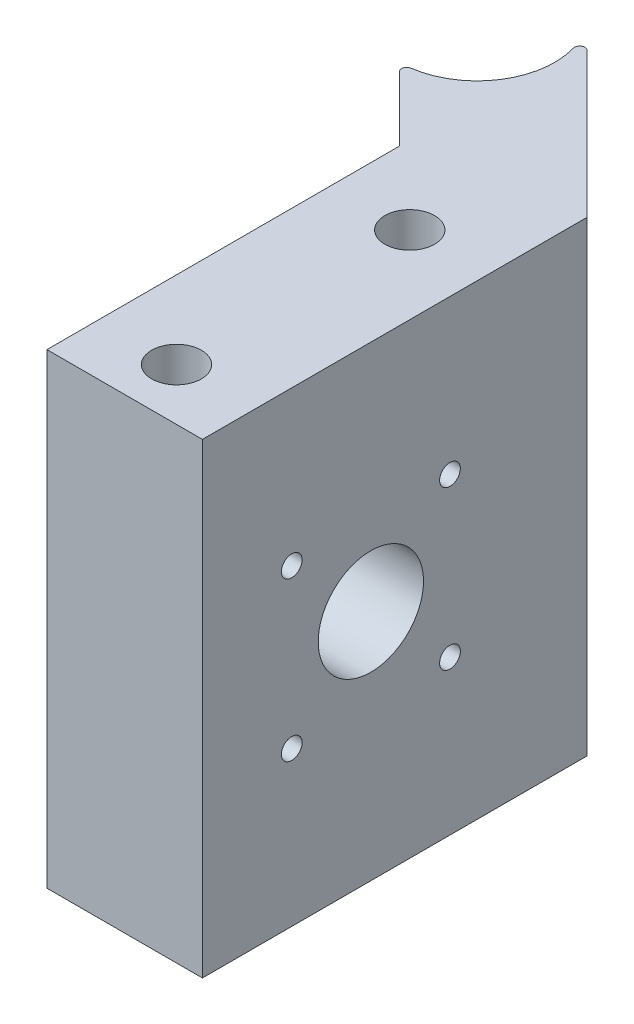
from build123d import *

# Parameters (mm, degrees)
SKETCH1_R           = 2.4
BOSS_EXTRUDE1_DEPTH = 45
CUT_EXTRUDE1_REACH  = 71.934
SKETCH2_R           = 5.0800000000000045
SKETCH2_R_2         = 1.0000000000000009
SKETCH2_R_3         = 1.0000000000000018
FILLET1_R           = 0.5
CUT_EXTRUDE2_DEPTH  = 2
CUT_EXTRUDE3_START  = 17
CUT_EXTRUDE3_DEPTH  = 2


with BuildPart() as part:
    # Sketch1 → Boss-Extrude1 (new body)
    with BuildSketch(Plane(origin=(0, 0, 0), x_dir=(1, 0, 0), z_dir=(0, 1, 0))):
        with BuildLine():
            Line((-7.499999999999999, -5.000000000000001), (7.500000000000001, -4.999999999999999))
            Line((7.500000000000001, -5), (7.4999999999999964, 32.10660171779804))
            Line((7.499999999999998, 32.10660171779804), (-9.196699141100867, 48.80330085889908))
            ThreePointArc((-9.196699141100867, 48.80330085889908), (-7.57090350616536, 40.62987425726181), (-14.499999999999998, 36))
            Line((-14.499999999999998, 36), (-7.5, 28.999999999999925))
            Line((-7.5, 28.99999999999993), (-7.499999999999999, -5.000000000000001))
        make_face()
        Circle(SKETCH1_R, mode=Mode.SUBTRACT)
        with Locations((0, 22.5)):
            Circle(SKETCH1_R, mode=Mode.SUBTRACT)
    extrude(amount=BOSS_EXTRUDE1_DEPTH)

    # Sketch2 → Cut-Extrude1 (cut, up to next)
    with BuildSketch(Plane(origin=(7.5, 0, -8.8e-16), x_dir=(-1.2e-16, 0, -1), z_dir=(1, 0, -1.2e-16)), mode=Mode.PRIVATE) as cut_extrude1_sk1:
        with Locations((11.25, 22.5)):
            Circle(SKETCH2_R)
    cut_extrude1_tool1 = extrude(cut_extrude1_sk1.sketch, amount=-CUT_EXTRUDE1_REACH, mode=Mode.PRIVATE) & part.part
    # Sketch2 → Cut-Extrude1 (cut, up to next)
    with BuildSketch(Plane(origin=(7.5, 0, -8.8e-16), x_dir=(-1.2e-16, 0, -1), z_dir=(1, 0, -1.2e-16)), mode=Mode.PRIVATE) as cut_extrude1_sk2:
        with Locations((3.616999999999997, 30.133)):
            Circle(SKETCH2_R_2)
    cut_extrude1_tool2 = extrude(cut_extrude1_sk2.sketch, amount=-CUT_EXTRUDE1_REACH, mode=Mode.PRIVATE) & part.part
    # Sketch2 → Cut-Extrude1 (cut, up to next)
    with BuildSketch(Plane(origin=(7.5, 0, -8.8e-16), x_dir=(-1.2e-16, 0, -1), z_dir=(1, 0, -1.2e-16)), mode=Mode.PRIVATE) as cut_extrude1_sk3:
        with Locations((18.882999999999996, 30.133)):
            Circle(SKETCH2_R_3)
    cut_extrude1_tool3 = extrude(cut_extrude1_sk3.sketch, amount=-CUT_EXTRUDE1_REACH, mode=Mode.PRIVATE) & part.part
    # Sketch2 → Cut-Extrude1 (cut, up to next)
    with BuildSketch(Plane(origin=(7.5, 0, -8.8e-16), x_dir=(-1.2e-16, 0, -1), z_dir=(1, 0, -1.2e-16)), mode=Mode.PRIVATE) as cut_extrude1_sk4:
        with Locations((18.883, 14.867)):
            Circle(SKETCH2_R_3)
    cut_extrude1_tool4 = extrude(cut_extrude1_sk4.sketch, amount=-CUT_EXTRUDE1_REACH, mode=Mode.PRIVATE) & part.part
    # Sketch2 → Cut-Extrude1 (cut, up to next)
    with BuildSketch(Plane(origin=(7.5, 0, -8.8e-16), x_dir=(-1.2e-16, 0, -1), z_dir=(1, 0, -1.2e-16)), mode=Mode.PRIVATE) as cut_extrude1_sk5:
        with Locations((3.6169999999999987, 14.867)):
            Circle(SKETCH2_R_2)
    cut_extrude1_tool5 = extrude(cut_extrude1_sk5.sketch, amount=-CUT_EXTRUDE1_REACH, mode=Mode.PRIVATE) & part.part
    add(cut_extrude1_tool1.solids().sort_by_distance((7.5, 22.5, -11.25))[0], mode=Mode.SUBTRACT)
    add(cut_extrude1_tool2.solids().sort_by_distance((7.5, 30.133, -3.617))[0], mode=Mode.SUBTRACT)
    add(cut_extrude1_tool3.solids().sort_by_distance((7.5, 30.133, -18.883))[0], mode=Mode.SUBTRACT)
    add(cut_extrude1_tool4.solids().sort_by_distance((7.5, 14.867, -18.883))[0], mode=Mode.SUBTRACT)
    add(cut_extrude1_tool5.solids().sort_by_distance((7.5, 14.867, -3.617))[0], mode=Mode.SUBTRACT)

    # Fillet1
    fillet1_edges = [part.edges().sort_by_distance(p)[0] for p in [
        (-9.196699141100865, 22.5, -48.80330085889908),
        (-14.499999999999998, 22.5, -36),
    ]]
    fillet(fillet1_edges, radius=FILLET1_R)

    # Sketch3 → Cut-Extrude2 (cut, symmetric)
    with BuildSketch(Plane(origin=(0, 22.5, 0), x_dir=(1, 0, 0), z_dir=(0, 1, 0))):
        with BuildLine():
            Line((-8.136038969321103, 37.136038969321035), (-2.832738110421976, 42.43933982822012))
            Line((-2.832738110421976, 42.43933982822012), (-1.7720779386421575, 41.37867965644029))
            Line((-1.7720779386421575, 41.37867965644029), (-7.075378797541289, 36.07537879754121))
            ThreePointArc((-7.075378797541289, 36.07537879754121), (-9.276718417433411, 34.39135962345529), (-11.841997191011876, 33.341997191011835))
            Line((-11.841997191011876, 33.341997191011835), (-13.108259049699234, 34.60825904969921))
            ThreePointArc((-13.108259049699234, 34.60825904969921), (-10.421379383302021, 35.477229040721255), (-8.136038969321103, 37.136038969321035))
        make_face()
    extrude(amount=CUT_EXTRUDE2_DEPTH, both=True, mode=Mode.SUBTRACT)

    # Sketch3<2> → Cut-Extrude3 (cut, symmetric)
    with BuildSketch(Plane(origin=(0, 22.5, 0), x_dir=(1, 0, 0), z_dir=(0, 1, 0)).offset(CUT_EXTRUDE3_START)):
        with BuildLine():
            Line((-8.136038969321103, 37.136038969321035), (-2.832738110421976, 42.43933982822012))
            Line((-2.832738110421976, 42.43933982822012), (-1.7720779386421575, 41.37867965644029))
            Line((-1.7720779386421575, 41.37867965644029), (-7.075378797541289, 36.07537879754121))
            ThreePointArc((-7.075378797541289, 36.07537879754121), (-9.276718417433411, 34.39135962345529), (-11.841997191011876, 33.341997191011835))
            Line((-11.841997191011876, 33.341997191011835), (-13.108259049699234, 34.60825904969921))
            ThreePointArc((-13.108259049699234, 34.60825904969921), (-10.421379383302021, 35.477229040721255), (-8.136038969321103, 37.136038969321035))
        make_face()
    cut_extrude3 = extrude(amount=CUT_EXTRUDE3_DEPTH, both=True, mode=Mode.SUBTRACT)

    # Mirror1: Cut-Extrude3 across plane
    add(cut_extrude3.mirror(Plane.ZX.offset(22.5)), mode=Mode.SUBTRACT)


solid = part.part
